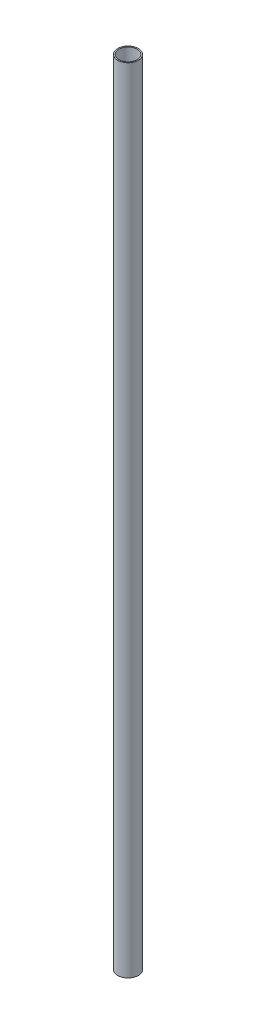
from build123d import *

# Parameters (mm, degrees)
SKETCH1_R           = 13
SKETCH1_R_2         = 11.5
BOSS_EXTRUDE1_DEPTH = 1000


with BuildPart() as part:
    # Sketch1 → Boss-Extrude1 (new body)
    with BuildSketch(Plane(origin=(0, 0, 0), x_dir=(1, 0, 0), z_dir=(0, 1, 0))):
        Circle(SKETCH1_R)
        Circle(SKETCH1_R_2, mode=Mode.SUBTRACT)
    extrude(amount=BOSS_EXTRUDE1_DEPTH)


solid = part.part
